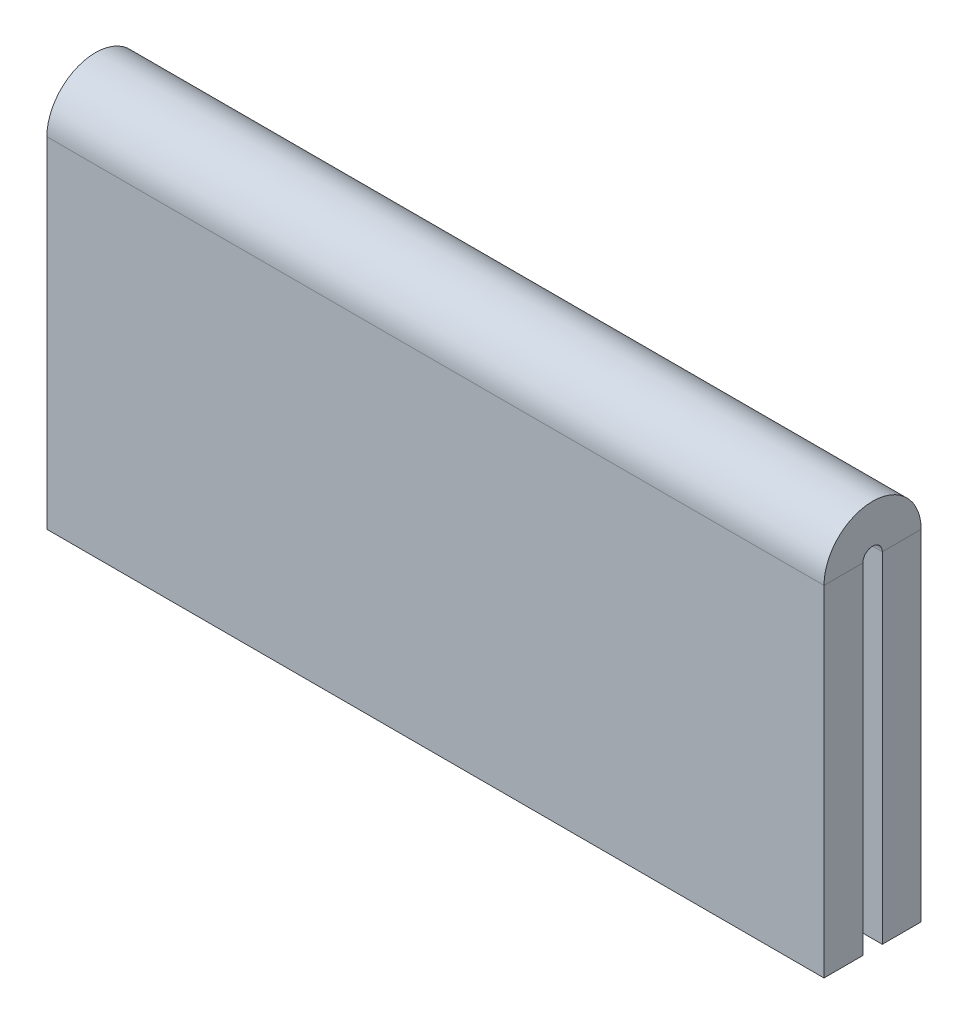
from build123d import *

# Parameters (mm, degrees)
SKETCH_1_W       = 20
SKETCH_1_H       = 10
BASEPLATE_DEPTH  = 1
HEM_OPEN_DEPTH   = 20
HEM_OPEN_2_DEPTH = 20


# Read off the part's stored shape, not the designer's step: Hem_open
# Sheet-metal steps are written as plain solids
with BuildPart() as part:
    # Sketch 1 → BasePlate (new body)
    with BuildSketch(Plane.XY):
        with Locations((10, 5)):
            Rectangle(SKETCH_1_W, SKETCH_1_H)
    extrude(amount=-BASEPLATE_DEPTH)

    # Hem_open outline → Hem_open (cut)
    with BuildSketch(Plane.YZ):
        with BuildLine():
            Line((10, 0), (9.974744871, 0))
            ThreePointArc((9.974744871, 0), (9.540569415, -0.718245837), (8.75, -1))
            Line((8.75, -1), (10, -1))
            Line((10, -1), (10, 0))
        make_face()
    extrude(amount=HEM_OPEN_DEPTH, mode=Mode.SUBTRACT)

    # Hem_open 2 outline → Hem_open 2 (add)
    with BuildSketch(Plane.YZ):
        with BuildLine():
            Line((0, 1.5), (0, 0.5))
            Line((0, 0.5), (8.75, 0.5))
            ThreePointArc((8.75, 0.5), (9, 0.25), (8.75, 0))
            Line((8.75, 0), (9.974744871, 0))
            ThreePointArc((9.974744871, 0), (9.718245837, 1.040569415), (8.75, 1.5))
            Line((8.75, 1.5), (0, 1.5))
        make_face()
    extrude(amount=HEM_OPEN_2_DEPTH)


solid = part.part
